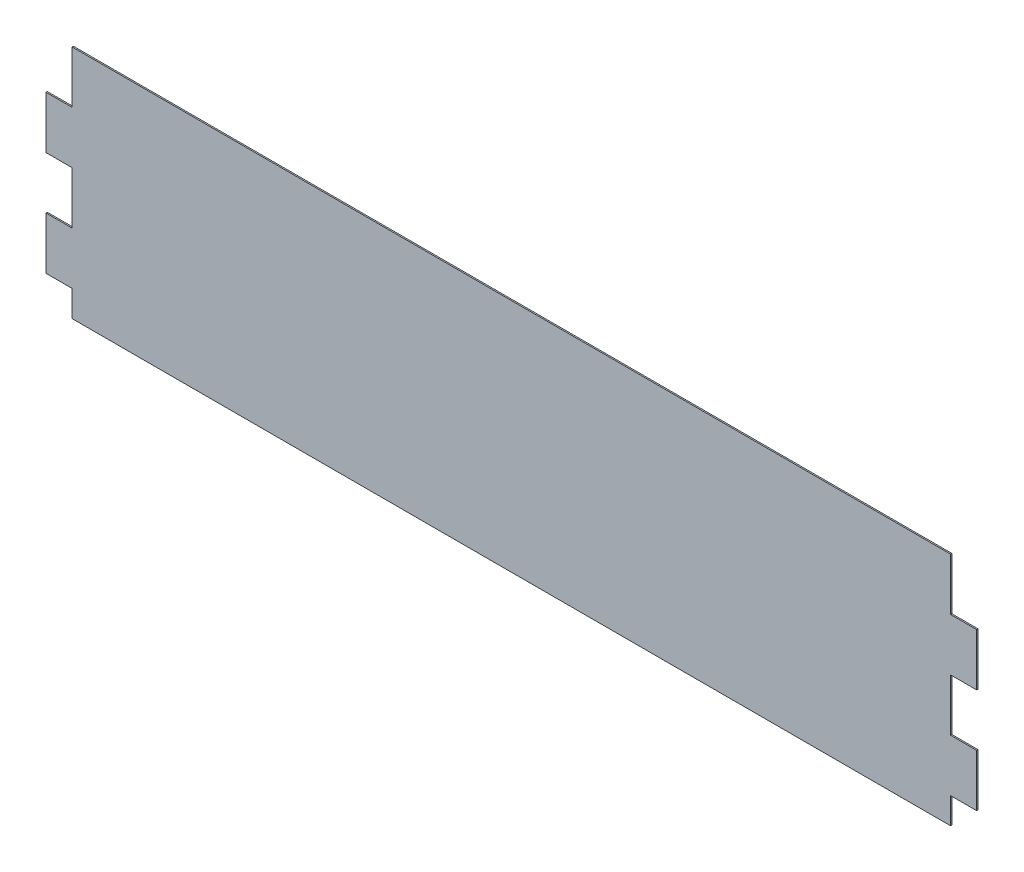
from build123d import *

# Parameters (mm, degrees)
BOSS_EXTRUDE1_DEPTH  = 0.125
SKETCH3_W            = 5
SKETCH3_H            = 10
CUT_EXTRUDE1_DEPTH   = 184.600279139
LPATTERN2_COUNT      = 4
LPATTERN2_PITCH      = 20
LPATTERN2_COUNT_DIR2 = 2
LPATTERN2_PITCH_DIR2 = 173


with BuildPart() as part:
    # Sketch2 → Boss-Extrude1 (new, symmetric)
    with BuildSketch(Plane.XY):
        Polygon((0, 0), (5, 0), (173, 0), (178, 0), (178, 45), (0, 45), align=None)
    extrude(amount=BOSS_EXTRUDE1_DEPTH, both=True)

    # Sketch3 → Cut-Extrude1 (cut, through all)
    with BuildSketch(Plane.XY.offset(0.125)):
        with Locations((2.5, 40)):
            Rectangle(SKETCH3_W, SKETCH3_H)
    cut_extrude1 = extrude(amount=-CUT_EXTRUDE1_DEPTH, mode=Mode.SUBTRACT)

    # LPattern2: Cut-Extrude1 4 × 2
    with Locations(*[(j * LPATTERN2_PITCH_DIR2, -i * LPATTERN2_PITCH, 0) for i in range(LPATTERN2_COUNT) for j in range(LPATTERN2_COUNT_DIR2) if (i, j) != (0, 0)]):
        add(cut_extrude1, mode=Mode.SUBTRACT)


solid = part.part
